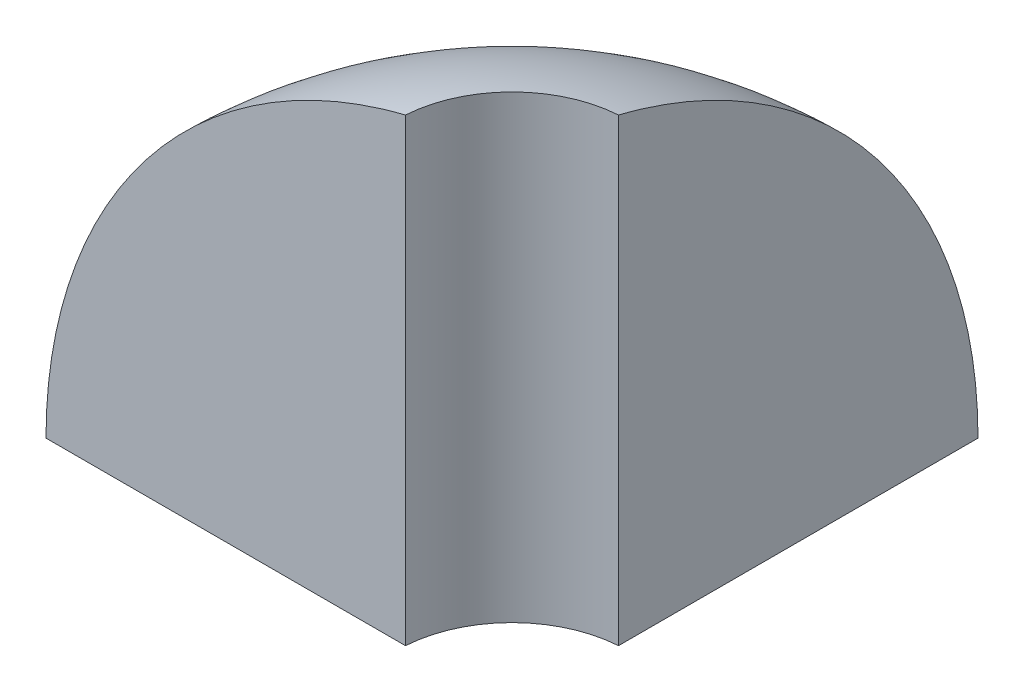
from build123d import *

# Parameters (mm, degrees)
CUT_EXTRUDE1_DEPTH      = 55.559600438
CUT_EXTRUDE1_DEPTH_BACK = 55.559600438
SKETCH3_W               = 31.496031496
SKETCH3_H               = 31.496031496
CUT_EXTRUDE2_DEPTH      = 55.263283798
SKETCH6_R               = 7.6
CUT_EXTRUDE3_DEPTH      = 55.550435379


with BuildPart() as part:
    # Sketch1 → Revolve1 (revolve)
    with BuildSketch(Plane.XY):
        with BuildLine():
            Line((0, 31.5), (0, -31.5))
            ThreePointArc((0, -31.5), (-31.5, 0), (0, 31.5))
        make_face()
    revolve(axis=Axis((0, 31.5, 0), (0, -1, 0)))

    # Sketch2 → Cut-Extrude1 (cut, two sides: drawn at the far end of the back side and taken through both)
    with BuildSketch(Plane(origin=(0, 0, 0), x_dir=(1, 0, 0), z_dir=(0, 1, 0)).offset(-CUT_EXTRUDE1_DEPTH_BACK)):
        with BuildLine():
            Line((-0.5, 31.496031496), (-0.5, 0.5))
            Line((-0.5, 0.5), (-31.496031496, 0.5))
            ThreePointArc((-31.496031496, 0.5), (22.273863607, -22.273863607), (-0.5, 31.496031496))
        make_face()
    extrude(amount=CUT_EXTRUDE1_DEPTH + CUT_EXTRUDE1_DEPTH_BACK, mode=Mode.SUBTRACT)

    # Sketch3 → Cut-Extrude2 (cut, through all)
    with BuildSketch(Plane(origin=(-0.5, 0, 0), x_dir=(0, 0, -1), z_dir=(1, 0, 0))):
        with Locations((15.748015748, -15.748015748)):
            Rectangle(SKETCH3_W, SKETCH3_H)
    extrude(amount=-CUT_EXTRUDE2_DEPTH, mode=Mode.SUBTRACT)

    # Sketch6 → Cut-Extrude3 (cut, through all)
    with BuildSketch(Plane.XZ):
        Circle(SKETCH6_R)
    extrude(amount=-CUT_EXTRUDE3_DEPTH, mode=Mode.SUBTRACT)


solid = part.part
